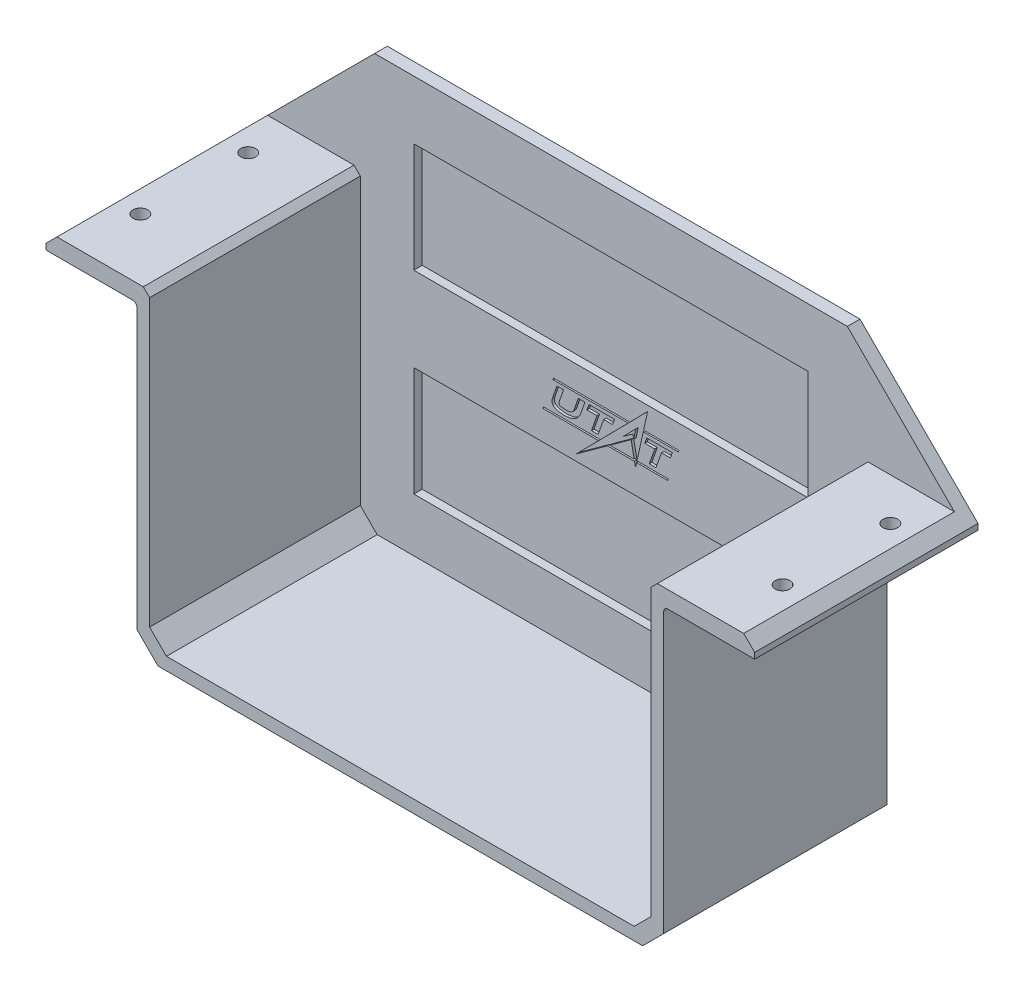
from build123d import *

# Parameters (mm, degrees)
SKETCH1_W           = 125
SKETCH1_H           = 76.2
BOSS_EXTRUDE1_DEPTH = 3
SKETCH2_W           = 3
SKETCH2_H           = 76.2
BOSS_EXTRUDE2_DEPTH = 50
SKETCH4_W           = 53
SKETCH4_H           = 4
BOSS_EXTRUDE4_DEPTH = 21.59
SKETCH5_W           = 53
SKETCH5_H           = 4
BOSS_EXTRUDE5_DEPTH = 21.59
SKETCH6_W           = 168.18
SKETCH6_H           = 25.4
BOSS_EXTRUDE6_DEPTH = 3
CHAMFER1_SIZE       = 28
SKETCH7_W           = 93.6
SKETCH7_H           = 26
CUT_EXTRUDE1_DEPTH  = 2
SKETCH9_W           = 119
SKETCH9_H           = 3
BOSS_EXTRUDE7_DEPTH = 50
CHAMFER2_SIZE       = 4
CHAMFER3_SIZE       = 5
CUT_EXTRUDE2_START  = -0.6
CUT_EXTRUDE2_DEPTH  = 0.6
SKETCH11_R          = 1.75
CUT_EXTRUDE3_DEPTH  = 5
FILLET1_R           = 1
CHAMFER4_SIZE       = 1.5
SKETCH13_R          = 1.75
CUT_EXTRUDE4_DEPTH  = 10


# Read off the part's stored shape, not the designer's step: Cut-Extrude2
with BuildPart() as part:
    # Sketch1 → Boss-Extrude1 (new body)
    with BuildSketch(Plane.XY):
        Rectangle(SKETCH1_W, SKETCH1_H)
    extrude(amount=BOSS_EXTRUDE1_DEPTH)

    # Sketch2 → Boss-Extrude2 (add)
    with BuildSketch(Plane.XY.offset(3)):
        with Locations((-61, 0)):
            Rectangle(SKETCH2_W, SKETCH2_H)
        with Locations((61, 0)):
            Rectangle(SKETCH2_W, SKETCH2_H)
    extrude(amount=BOSS_EXTRUDE2_DEPTH)

    # Sketch4 → Boss-Extrude4 (add)
    with BuildSketch(Plane.ZY.offset(62.5)):
        with Locations((26.5, 36.1)):
            Rectangle(SKETCH4_W, SKETCH4_H)
    extrude(amount=BOSS_EXTRUDE4_DEPTH)

    # Sketch5 → Boss-Extrude5 (add)
    with BuildSketch(Plane(origin=(62.5, 0, 0), x_dir=(0, 0, -1), z_dir=(1, 0, 0))):
        with Locations((-26.5, 36.1)):
            Rectangle(SKETCH5_W, SKETCH5_H)
    extrude(amount=BOSS_EXTRUDE5_DEPTH)

    # Sketch6 → Boss-Extrude6 (add)
    with BuildSketch(Plane(origin=(0, 0, 0), x_dir=(-1, 0, 0), z_dir=(0, 0, -1))):
        with Locations((0, 50.8)):
            Rectangle(SKETCH6_W, SKETCH6_H)
    extrude(amount=-BOSS_EXTRUDE6_DEPTH)

    # Chamfer1
    chamfer1_edges = [part.edges().sort_by_distance(p)[0] for p in [
        (-84.09, 63.5, 1.5),
        (84.09, 63.5, 1.5),
    ]]
    chamfer(chamfer1_edges, length=CHAMFER1_SIZE)

    # Sketch7 → Cut-Extrude1 (cut)
    with BuildSketch(Plane.XY.offset(3)):
        with Locations((0, -9.4)):
            Rectangle(SKETCH7_W, SKETCH7_H)
        with Locations((0, 36.6)):
            Rectangle(SKETCH7_W, SKETCH7_H)
    extrude(amount=-CUT_EXTRUDE1_DEPTH, mode=Mode.SUBTRACT)

    # Sketch9 → Boss-Extrude7 (add)
    with BuildSketch(Plane.XY.offset(3)):
        with Locations((0, -36.6)):
            Rectangle(SKETCH9_W, SKETCH9_H)
    extrude(amount=BOSS_EXTRUDE7_DEPTH)

    # Chamfer2
    chamfer2_edges = [part.edges().sort_by_distance(p)[0] for p in [
        (-59.5, -35.1, 28),
        (59.5, -35.1, 28),
    ]]
    chamfer(chamfer2_edges, length=CHAMFER2_SIZE)

    # Chamfer3
    chamfer3_edges = [part.edges().sort_by_distance(p)[0] for p in [
        (62.5, -38.1, 26.5),
        (-62.5, -38.1, 26.5),
    ]]
    chamfer(chamfer3_edges, length=CHAMFER3_SIZE)

    # Cut-Extrude2 outline → Cut-Extrude2 (cut)
    # profile 1 of 4: a face of its own
    with BuildSketch(Plane.XY.offset(3).offset(CUT_EXTRUDE2_START)):
        with BuildLine():
            Line((-12.843793417, 16.784775128), (-13.918894641, 13.722312614))
            add(Edge.make_bspline(
                [(-13.918894641, 13.722312614), (-13.950745906, 13.608646354), (-13.97919001, 13.483685694), (-14.011317489, 13.235305925), (-14.01541758, 13.110841548), (-13.989547543, 12.867284383), (-13.959604678, 12.747961158), (-13.857332343, 12.519974586), (-13.78490702, 12.411398187), (-13.592313629, 12.212018271), (-13.472083062, 12.121314997), (-13.184369222, 11.962818623), (-13.016909084, 11.895027419), (-12.454211206, 11.728033285), (-11.997806272, 11.664794493), (-11.025815686, 11.62704002), (-10.511530183, 11.651603075), (-9.78258436, 11.770518687), (-9.546683753, 11.824200176), (-9.102156978, 11.962599668), (-8.89364967, 12.047436893), (-8.514064046, 12.246658938), (-8.343153207, 12.361026326), (-8.04132547, 12.611058926), (-7.910418089, 12.746448479), (-7.679883041, 13.0275306), (-7.579636344, 13.172799488), (-7.44297026, 13.39668043), (-7.39971151, 13.472431032), (-7.318663078, 13.627460279), (-7.280772846, 13.706786212), (-7.248185858, 13.788667895)],
                knots=[0, 0, 0, 0, 0.0625, 0.0625, 0.125, 0.125, 0.1875, 0.1875, 0.25, 0.25, 0.3125, 0.3125, 0.375, 0.375, 0.5, 0.5, 0.625, 0.625, 0.6875, 0.6875, 0.75, 0.75, 0.8125, 0.8125, 0.875, 0.875, 0.9375, 0.9375, 0.96875, 0.96875, 1, 1, 1, 1], degree=3))
            Line((-7.248185858, 13.788667895), (-6.196379448, 16.784775128))
            Line((-6.196379448, 16.784775128), (-7.771512854, 16.784775171))
            Line((-7.771512854, 16.784775171), (-8.779640442, 13.913087848))
            add(Edge.make_bspline(
                [(-8.779640442, 13.913087848), (-8.801212863, 13.867686768), (-8.828630281, 13.811426743), (-8.890437912, 13.684919137), (-8.925723343, 13.615289873), (-9.014867696, 13.477778317), (-9.069034752, 13.410065742), (-9.20356673, 13.286811644), (-9.283951715, 13.231246188), (-9.470687062, 13.136081945), (-9.576947425, 13.096402347), (-9.809000897, 13.032201026), (-9.934689567, 13.00760449), (-10.326953956, 12.952228061), (-10.607716868, 12.939250309), (-11.138236784, 12.940792557), (-11.387946526, 12.95495502), (-11.815776289, 13.010911905), (-11.994686961, 13.05312605), (-12.19022456, 13.154353945), (-12.243244201, 13.194586759), (-12.322270156, 13.289978248), (-12.348136332, 13.345299657), (-12.373130151, 13.46826163), (-12.371956966, 13.5361378), (-12.35254935, 13.67085438), (-12.333771283, 13.737944141), (-12.322165603, 13.788667937)],
                knots=[0, 0, 0, 0, 0.0625, 0.0625, 0.125, 0.125, 0.1875, 0.1875, 0.25, 0.25, 0.3125, 0.3125, 0.375, 0.375, 0.5, 0.5, 0.625, 0.625, 0.75, 0.75, 0.8125, 0.8125, 0.875, 0.875, 0.9375, 0.9375, 1, 1, 1, 1], degree=3))
            Line((-12.322165603, 13.788667937), (-11.2703582, 16.784775128))
            Line((-11.2703582, 16.784775128), (-12.843793417, 16.784775128))
        make_face()
    # profile 2 of 4: a face of its own
    with BuildSketch(Plane.XY.offset(3).offset(CUT_EXTRUDE2_START)):
        Polygon((14.082145905, 15.466432145), (14.547318434, 16.784775128), (8.481425261, 16.784775128), (8.015662645, 15.45803385), (10.386127447, 15.45803385), (9.075451111, 11.743439605), (10.661733364, 11.743439605), (11.975372051, 15.466432145), align=None)
    # profile 3 of 4: a face of its own
    with BuildSketch(Plane.XY.offset(3).offset(CUT_EXTRUDE2_START)):
        Polygon((0.359928822, 15.45803385), (0.825593089, 16.784775128), (-5.237786258, 16.784775128), (-5.705919648, 15.45803385), (-3.328357423, 15.45803385), (-4.639000977, 11.723834147), (-3.059652234, 11.723834147), (-1.74900868, 15.45803385), align=None)
    # profile 4 of 4: a face of its own
    with BuildSketch(Plane.XY.offset(3).offset(CUT_EXTRUDE2_START)):
        Polygon((7.732615088, 18.009820452), (8.67993853, 22.298690548), (4.451236342, 18.010625114), (-13.617285872, 18.010625114), (-13.760696138, 17.631800344), (4.083976363, 17.631800344), (-2.561139847, 10.89339914), (-16.036862666, 10.89339914), (-16.175076152, 10.505618026), (-2.943552817, 10.505618026), (-8.264964605, 5.10950355), (-0.819885517, 10.505618026), (5.569839691, 10.505618026), (5.813932632, 9.32327198), (6.07620201, 10.510665049), (13.482070183, 10.510665049), (13.624063348, 10.89339914), (6.160742258, 10.89339914), (7.649117922, 17.631800344), (15.972876762, 17.631800344), (16.113123511, 18.009820452), align=None)
        Polygon((-0.283933962, 10.894070437), (4.780674194, 14.564845582), (5.489286994, 10.894070437), align=None, mode=Mode.SUBTRACT)
        Polygon((5.863139247, 17.323666682), (5.364033793, 14.945937564), (5.179256414, 15.9244998), (2.885975157, 14.289472868), align=None, mode=Mode.SUBTRACT)
    extrude(amount=CUT_EXTRUDE2_DEPTH, mode=Mode.SUBTRACT)

    # Sketch11 → Cut-Extrude3 (cut)
    with BuildSketch(Plane(origin=(0, 38.1, 0), x_dir=(1, 0, 0), z_dir=(0, 1, 0))):
        with Locations(Location((-76.11, -13, 0), (0, 0, 270))):
            Circle(SKETCH11_R)
        with Locations(Location((76.29, -13, 0), (0, 0, 270))):
            Circle(SKETCH11_R)
    extrude(amount=-CUT_EXTRUDE3_DEPTH, mode=Mode.SUBTRACT)

    # Fillet1
    fillet1_edges = [part.edges().sort_by_distance(p)[0] for p in [
        (-62.5, 34.1, 26.5),
        (62.5, 34.1, 26.5),
    ]]
    fillet(fillet1_edges, radius=FILLET1_R)

    # Chamfer4
    chamfer4_edges = [part.edges().sort_by_distance(p)[0] for p in [
        (-59.5, 38.1, 28),
        (59.5, 38.1, 28),
    ]]
    chamfer(chamfer4_edges, length=CHAMFER4_SIZE)

    # Sketch13 → Cut-Extrude4 (cut)
    with BuildSketch(Plane(origin=(0, 38.1, 0), x_dir=(1, 0, 0), z_dir=(0, 1, 0))):
        with Locations(Location((-76.29, -38.4, 0), (0, 0, 270))):
            Circle(SKETCH13_R)
        with Locations(Location((76.11, -38.4, 0), (0, 0, 270))):
            Circle(SKETCH13_R)
    extrude(amount=-CUT_EXTRUDE4_DEPTH, mode=Mode.SUBTRACT)


solid = part.part
